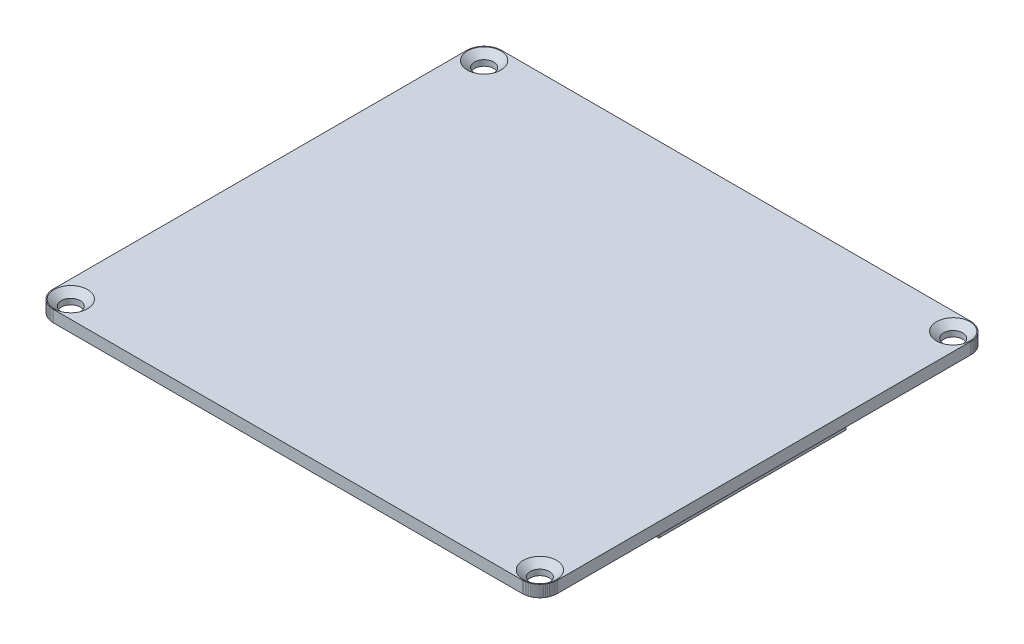
from build123d import *

# Parameters (mm, degrees)
BOSS_EXTRUDE1_DEPTH = 2
CUT_EXTRUDE1_DEPTH  = 0.5
SKETCH4_W           = 4
SKETCH4_H           = 32
BOSS_EXTRUDE2_DEPTH = 2.45


# Read off the part's stored shape, not the designer's step: Cut-Extrude1
with BuildPart() as part:
    # Model → Boss-Extrude1 (new body)
    with BuildSketch(Plane(origin=(0, 0, 0), x_dir=(1, 0, 0), z_dir=(0, 1, 0))):
        Polygon((83.2017154, 76.67663), (83.4360154, 76.66713), (83.6702154, 76.64103), (83.9020154, 76.59413), (84.1278154, 76.53063), (84.3497154, 76.44803), (84.5620154, 76.35033), (84.7688154, 76.23463), (84.9642154, 76.10483), (85.1491154, 75.95873), (85.3226154, 75.79893), (85.4824154, 75.62533), (85.6285154, 75.44083), (85.7580154, 75.24503), (85.8737154, 75.03833), (85.9732154, 74.82453), (86.0543154, 74.60403), (86.1178154, 74.37683), (86.1647154, 74.14683), (86.1908154, 73.91263), (86.2018154, 73.67693), (86.2018154, 2.99999), (86.1908154, 2.76572), (86.1647154, 2.53146), (86.1178154, 2.29995), (86.0543154, 2.07395), (85.9732154, 1.85208), (85.8737154, 1.63986), (85.7580154, 1.43316), (85.6285154, 1.23748), (85.4824154, 1.05282), (85.3226154, 0.87919), (85.1491154, 0.719336), (84.9642154, 0.573265), (84.7688154, 0.443728), (84.5620154, 0.327971), (84.3497154, 0.228753), (84.1278154, 0.14745), (83.9020154, 0.08406), (83.6702154, 0.037207), (83.4360154, 0.011024), (83.2003154, 0), (2.9999854, 0), (2.7643454, 0.011024), (2.5300754, 0.037207), (2.2999454, 0.08406), (2.0725654, 0.14745), (1.8520854, 0.228753), (1.6384854, 0.327971), (1.4317854, 0.443728), (1.2361054, 0.573265), (1.0514454, 0.719336), (0.8778094, 0.87919), (0.7179584, 1.05282), (0.5718874, 1.23748), (0.4423514, 1.43316), (0.3265944, 1.63986), (0.2287544, 1.85208), (0.1460724, 2.07395), (0.0826824, 2.29995), (0.0358294, 2.53146), (0.0096464, 2.76572), (0, 3.00137), (0, 73.67693), (0.0096464, 73.91263), (0.0358294, 74.14683), (0.0826824, 74.37683), (0.1460724, 74.60403), (0.2287544, 74.82453), (0.3265944, 75.03833), (0.4423514, 75.24503), (0.5718874, 75.44083), (0.7179584, 75.62533), (0.8778094, 75.79893), (1.0514454, 75.95873), (1.2361054, 76.10483), (1.4317854, 76.23463), (1.6384854, 76.35033), (1.8520854, 76.44803), (2.0725654, 76.53063), (2.2999454, 76.59413), (2.5300754, 76.64103), (2.7643454, 76.66713), (2.9999854, 76.67663), align=None)
    extrude(amount=BOSS_EXTRUDE1_DEPTH)

    # Sketch2 → CSK for #4 Flat Head Machine Screw (100)1 (revolve, cut)
    with BuildSketch(Plane(origin=(2.997, 2, -73.67963), x_dir=(0, 0, 1), z_dir=(1, 0, 0))):
        Polygon((0, 0), (0, 2), (1.63195, 2), (1.63195, 1.028358553), (2.8575, 0), align=None)
    csk_for_4_flat_head_machine_screw_100 = revolve(axis=Axis((2.997, 8.35, -73.67963), (0, -1, 0)), mode=Mode.SUBTRACT)

    # Mirror1: CSK for #4 Flat Head Machine Screw (100)1 across plane
    add(csk_for_4_flat_head_machine_screw_100.mirror(Plane(origin=(0, 0, -38.338315), x_dir=(1, 0, 0), z_dir=(0, 0, -1))), mode=Mode.SUBTRACT)

    # Mirror2: CSK for #4 Flat Head Machine Screw (100)1 across plane
    add(csk_for_4_flat_head_machine_screw_100.mirror(Plane.ZY.offset(-43.1009077)), mode=Mode.SUBTRACT)

    # Mirror2 copy 1 sketch → Mirror2 copy 1 (revolve, cut)
    with BuildSketch(Plane(origin=(83.2048154, 2, -2.997), x_dir=(0, 0, -1), z_dir=(-1, 0, 0))):
        Polygon((0, 0), (0, 2), (1.63195, 2), (1.63195, 1.028358553), (2.8575, 0), align=None)
    revolve(axis=Axis((83.2048154, 8.35, -2.997), (0, -1, 0)), mode=Mode.SUBTRACT)

    # Cut-Extrude1 outline → Cut-Extrude1 (cut)
    with BuildSketch(Plane(origin=(0, 0, 0), x_dir=(1, 0, 0), z_dir=(0, 1, 0))):
        Polygon((32.509127242, 16.391083794), (53.691475511, 16.390890415), (58.023721683, 20.78109507), (28.176961229, 20.781367548), align=None)
        Polygon((33.317156648, 41.822059745), (42.234902549, 41.821978333), (23.627775799, 55.282638618), align=None)
        Polygon((43.966140493, 41.821962528), (52.883886394, 41.821881116), (62.573513012, 55.282283073), align=None)
        Polygon((41.601152902, 43.661575059), (33.293285647, 61.967941537), (33.293177509, 50.122694657), align=None)
        Polygon((32.509172172, 21.312638788), (53.691520441, 21.312445409), (58.023766613, 25.702674107), (28.17700616, 25.702946585), align=None)
        Polygon((32.509241145, 26.234193782), (53.691541329, 26.234000404), (58.023811543, 30.624229101), (28.17705109, 30.624501579), align=None)
        Polygon((32.509262033, 31.155772819), (53.691610301, 31.15557944), (58.023856473, 35.545784095), (28.17709602, 35.546056574), align=None)
        Polygon((32.509306963, 36.077327813), (53.691655231, 36.077134434), (58.023901404, 40.467363132), (28.17714095, 40.46763561), align=None)
        Polygon((47.288434898, 52.533551253), (43.100804754, 71.67663), (38.912825087, 52.533627717), (43.100542034, 42.898810215), align=None)
        Polygon((52.908038454, 50.122515588), (52.908146592, 61.967762468), (44.599945092, 43.661547682), align=None)
        Polygon((58.023668535, 15.859534322), (28.176921839, 15.8598068), (36.500937499, 7.424097662), (49.699498852, 7.423977169), align=None)
    extrude(amount=CUT_EXTRUDE1_DEPTH, mode=Mode.SUBTRACT)

    # Sketch4 → Boss-Extrude2 (add)
    with BuildSketch(Plane.XZ):
        with Locations((4, -38.33846)):
            Rectangle(SKETCH4_W, SKETCH4_H)
    boss_extrude2 = extrude(amount=BOSS_EXTRUDE2_DEPTH)

    # Mirror3: Boss-Extrude2 across plane
    add(boss_extrude2.mirror(Plane.ZY.offset(-43.1009077)))


solid = part.part
